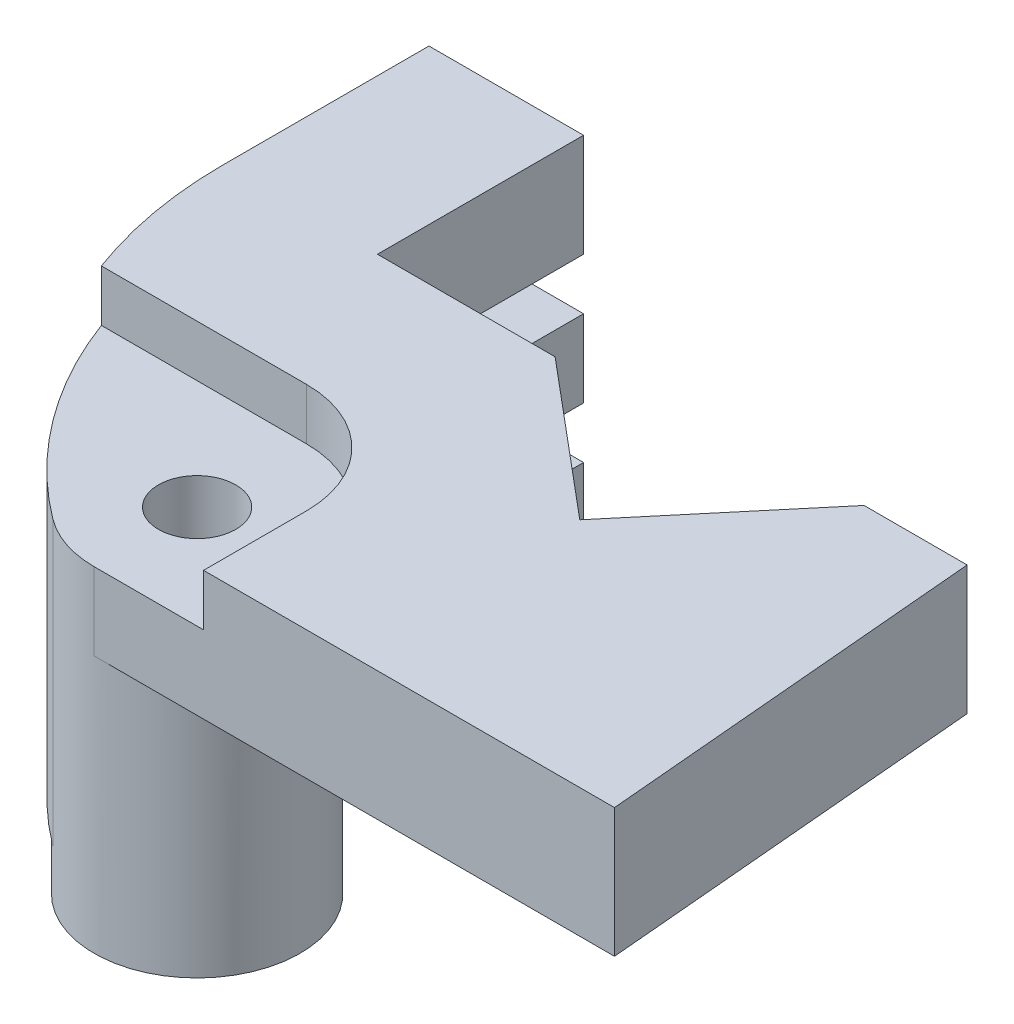
from build123d import *
from build123d.topology import SkipClean

# Parameters (mm, degrees)
SKETCH1_R           = 1.5
BOSS_EXTRUDE1_DEPTH = 5
BOSS_EXTRUDE2_START = 10
SKETCH2_R           = 1.5
BOSS_EXTRUDE2_DEPTH = 10
CUT_EXTRUDE1_DEPTH  = 2
SKETCH4_OUTSIDE_W   = 39.104
SKETCH4_OUTSIDE_H   = 31.904
SKETCH4_OUTSIDE_R   = 4
CUT_EXTRUDE2_DEPTH  = 2
FILLET4_R           = 7
CUT_EXTRUDE5_START  = -9
CUT_EXTRUDE5_DEPTH  = 7
CUT_EXTRUDE7_START  = 2
CUT_EXTRUDE7_DEPTH  = 2
LPATTERN1_COUNT     = 2
LPATTERN1_PITCH     = 5
CUT_EXTRUDE9_START  = -2
CUT_EXTRUDE9_DEPTH  = 2
LPATTERN2_COUNT     = 2
LPATTERN2_PITCH     = 5
FILLET5_START       = -6
FILLET5_DEPTH       = 2
FILLET5_START_2     = -1
FILLET5_2_DEPTH     = 1


with BuildPart() as part:
    # Sketch1 → Boss-Extrude1 (new body)
    with BuildSketch(Plane(origin=(0, 0, 0), x_dir=(1, 0, 0), z_dir=(0, 1, 0))):
        with BuildLine():
            Line((-12, 14), (-12, 22))
            Line((-12, 22), (-6, 22))
            Line((-6, 22), (-6, 14))
            Line((-6, 14), (0.894304297, 14))
            Line((0.894304297, 14), (6.85307226, 9))
            Line((6.85307226, 9), (11.887670047, 15))
            Line((11.887670047, 15), (15.887670047, 15))
            Line((15.887670047, 15), (17.2, 0))
            Line((17.2, 0), (-3, 0))
            ThreePointArc((-3, 0), (-4.264911064, 0.205266808), (-5.4, 0.8))
            ThreePointArc((-5.4, 0.8), (-10.258048651, 6.620975674), (-12, 14))
        make_face()
        with Locations(Location((-3, 4, 0), (0, 0, 270))):
            Circle(SKETCH1_R, mode=Mode.SUBTRACT)
    extrude(amount=BOSS_EXTRUDE1_DEPTH)

    # Sketch2 → Boss-Extrude2 (add)
    with SkipClean():  # the faces are left unmerged after this step: merging them gives an invalid solid
        with BuildSketch(Plane.XZ.offset(BOSS_EXTRUDE2_START)):
            with BuildLine():
                Line((-12, -14), (-12, -22))
                Line((-12, -22), (-6, -22))
                Line((-6, -22), (-6, -8))
                Line((-6, -8), (-3, -8))
                ThreePointArc((-3, -8), (1, -4), (-3, 0))
                ThreePointArc((-3, 0), (-4.264911064, -0.205266808), (-5.4, -0.8))
                ThreePointArc((-5.4, -0.8), (-10.258048651, -6.620975674), (-12, -14))
            make_face()
            with Locations(Location((-3, -4, 0), (0, 0, 270))):
                Circle(SKETCH2_R, mode=Mode.SUBTRACT)
        extrude(amount=-BOSS_EXTRUDE2_DEPTH)

    # Sketch3 → Cut-Extrude1 (cut)
    with SkipClean():  # the faces are left unmerged after this step: merging them gives an invalid solid
        with BuildSketch(Plane(origin=(0, 5, 0), x_dir=(1, 0, 0), z_dir=(0, 1, 0))):
            with BuildLine():
                Line((1.25, 4), (1.25, 0))
                Line((1.25, 0), (-10.965687828, 0))
                Line((-10.965687828, 0), (-10.965687828, 8.25))
                Line((-10.965687828, 8.25), (-3, 8.25))
                ThreePointArc((-3, 8.25), (0.00520382, 7.00520382), (1.25, 4))
            make_face()
        extrude(amount=-CUT_EXTRUDE1_DEPTH, mode=Mode.SUBTRACT)

    # Sketch4 outside → Cut-Extrude2 (cut)
    with SkipClean():  # the faces are left unmerged after this step: merging them gives an invalid solid
        with BuildSketch(Plane.XZ.offset(10)):
            with Locations((2.6, -11)):
                Rectangle(SKETCH4_OUTSIDE_W, SKETCH4_OUTSIDE_H)
            with Locations(Location((-3, -4, 0), (0, 0, 270))):
                Circle(SKETCH4_OUTSIDE_R, mode=Mode.SUBTRACT)
        extrude(amount=-CUT_EXTRUDE2_DEPTH, mode=Mode.SUBTRACT)

    # Fillet4
    # the kernel refuses this fillet: 7 mm, written as the material it adds along each edge
    with BuildSketch(Plane(origin=(-6, -8, -8), x_dir=(0, 0, -1), z_dir=(0, 1, 0))) as fillet4_piece_1:
        with BuildLine():
            CenterArc((5.744562647, -7), FILLET4_R, 90, 55.150095421)
            Line((0, -3), (0, 0))
            Line((0, 0), (5.744562647, 0))
        make_face()
    extrude(amount=8)

    # Sketch8 → Cut-Extrude5 (cut)
    with BuildSketch(Plane(origin=(0, 3, 0), x_dir=(1, 0, 0), z_dir=(0, 1, 0)).offset(CUT_EXTRUDE5_START)):
        with BuildLine():
            Line((-8.638425733, 4.018428517), (-7.577765561, 5.079088689))
            ThreePointArc((-7.577765561, 5.079088689), (-7.976368998, 5.645642084), (-8.348417241, 6.229977223))
            ThreePointArc((-8.348417241, 6.229977223), (-8.003073705, 8.1765706), (-6.027976147, 8.090097651))
            ThreePointArc((-6.027976147, 8.090097651), (-5.292329992, 7.335150748), (-4.61146284, 6.530452037))
            ThreePointArc((-4.61146284, 6.530452037), (-5.795929923, 5.087554995), (-5.897777479, 3.223542865))
            Line((-5.897777479, 3.223542865), (-6.976385628, 2.144934715))
            ThreePointArc((-6.976385628, 2.144934715), (-7.843003254, 3.050101797), (-8.638425733, 4.018428517))
        make_face()
    extrude(amount=CUT_EXTRUDE5_DEPTH, mode=Mode.SUBTRACT)

    # Sketch10 → Cut-Extrude7 (cut)
    with BuildSketch(Plane.XZ.offset(-1).offset(CUT_EXTRUDE7_START)):
        with BuildLine():
            Line((-8.638425733, -4.018428517), (-7.577765561, -5.079088689))
            Line((-7.577765561, -5.079088689), (-8.348417241, -6.229977223))
            ThreePointArc((-8.348417241, -6.229977223), (-8.556847764, -7.161149711), (-8.16150889, -8.029615404))
            Line((-8.16150889, -8.029615404), (-9.977158514, -6.084074194))
            ThreePointArc((-9.977158514, -6.084074194), (-9.346365817, -5.026251972), (-8.638425733, -4.018428517))
        make_face()
    cut_extrude7 = extrude(amount=-CUT_EXTRUDE7_DEPTH, mode=Mode.SUBTRACT)

    # LPattern1: Cut-Extrude7 ×2
    with Locations(*[(0, -i * LPATTERN1_PITCH, 0) for i in range(1, LPATTERN1_COUNT)]):
        add(cut_extrude7, mode=Mode.SUBTRACT)

    # Sketch11 → Cut-Extrude9 (cut)
    with BuildSketch(Plane.XZ.offset(8).offset(CUT_EXTRUDE9_START)):
        with BuildLine():
            Line((-12, -22), (-6, -22))
            Line((-6, -22), (-6, -11))
            Line((-6, -11), (-10.09871087, -8.633608176))
            ThreePointArc((-10.09871087, -8.633608176), (-9.7258799, -7.711529492), (-9.294878189, -6.815164858))
            Line((-9.294878189, -6.815164858), (-9.977158514, -6.084074194))
            ThreePointArc((-9.977158514, -6.084074194), (-11.486292808, -9.914851011), (-12, -14))
            Line((-12, -14), (-12, -22))
        make_face()
    cut_extrude9 = extrude(amount=-CUT_EXTRUDE9_DEPTH, mode=Mode.SUBTRACT)

    # LPattern2: Cut-Extrude9 ×2
    with Locations(*[(0, i * LPATTERN2_PITCH, 0) for i in range(1, LPATTERN2_COUNT)]):
        add(cut_extrude9, mode=Mode.SUBTRACT)

    # Fillet5: read off the stored shape, not the designer's step
    # Fillet5 outline → Fillet5 (cut)
    with BuildSketch(Plane(origin=(0, 0, 0), x_dir=(1, 0, 0), z_dir=(0, 1, 0)).offset(FILLET5_START)):
        with BuildLine():
            Line((-6, 13.744562647), (-6, 11))
            ThreePointArc((-6, 11), (-5.384425539, 10.558219215), (-4.899169706, 9.976300875))
            ThreePointArc((-4.899169706, 9.976300875), (-5.719158725, 11.781680575), (-6, 13.744562647))
        make_face()
    extrude(amount=FILLET5_DEPTH, mode=Mode.SUBTRACT)

    # Fillet5 2 outline → Fillet5 2 (cut)
    with BuildSketch(Plane(origin=(0, 0, 0), x_dir=(1, 0, 0), z_dir=(0, 1, 0)).offset(FILLET5_START_2)):
        with BuildLine():
            Line((-6, 13.744562647), (-6, 11))
            ThreePointArc((-6, 11), (-5.384425539, 10.558219215), (-4.899169706, 9.976300875))
            ThreePointArc((-4.899169706, 9.976300875), (-5.719158725, 11.781680575), (-6, 13.744562647))
        make_face()
    extrude(amount=FILLET5_2_DEPTH, mode=Mode.SUBTRACT)


solid = part.part
